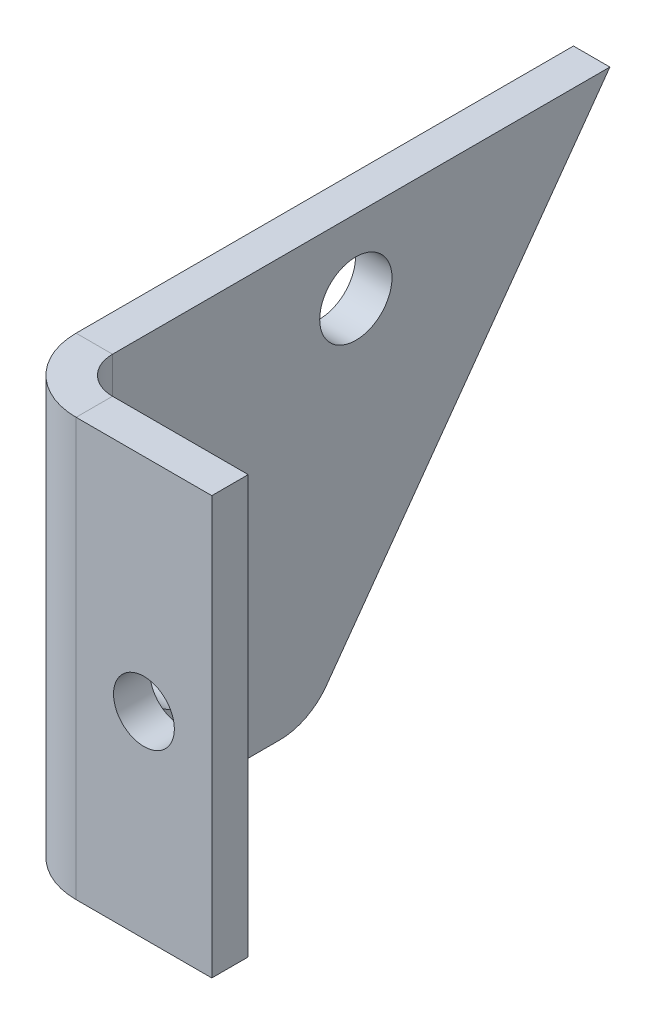
from build123d import *

# Parameters (mm, degrees)
BASE_FLANGE1_DEPTH           = 3.175
SKETCH7_R                    = 3.15
CUT_EXTRUDE3_DEPTH           = 10
EDGE_FLANGE1_STRIP_W         = 19.05
EDGE_FLANGE1_STRIP_H         = 3.175
EDGE_FLANGE1_STRIP_CUT_DEPTH = 36.40397533
EDGE_FLANGE1_DEPTH           = 36.40397533
SKETCH12_R                   = 2.65
CUT_EXTRUDE4_DEPTH           = 10


# Sheet-metal steps are written as plain solids
with BuildPart() as part:
    # Sketch2 → Base-Flange1 (new body)
    with BuildSketch(Plane(origin=(0, 0, 0), x_dir=(0, 0, -1), z_dir=(1, 0, 0))):
        with BuildLine():
            Line((0, 0), (0, 36.40397533))
            Line((0, 36.40397533), (49.693245392, 36.40397533))
            Line((49.693245392, 36.40397533), (24.989293369, 2.07924376))
            ThreePointArc((24.989293369, 2.07924376), (23.211005522, 0.550068473), (20.931069251, 0))
            Line((20.931069251, 0), (0, 0))
        make_face()
    extrude(amount=-BASE_FLANGE1_DEPTH)

    # Sketch7 → Cut-Extrude3 (cut)
    with BuildSketch(Plane.ZY.offset(3.175)):
        with Locations((-27.553898694, 30)):
            Circle(SKETCH7_R)
        with Locations((-12.587671369, 10)):
            Circle(SKETCH7_R)
    extrude(amount=-CUT_EXTRUDE3_DEPTH, mode=Mode.SUBTRACT)

    # Edge-Flange1 strip (across the edge) → Edge-Flange1 strip cut (cut)
    with BuildSketch(Plane(origin=(0, 36.40397533, 0), x_dir=(0, 0, -1), z_dir=(0, -1, 0))):
        with Locations((-3.175, -1.5875)):
            Rectangle(EDGE_FLANGE1_STRIP_W, EDGE_FLANGE1_STRIP_H)
    extrude(amount=EDGE_FLANGE1_STRIP_CUT_DEPTH, mode=Mode.SUBTRACT)

    # Edge-Flange1 section (across the edge) → Edge-Flange1 (add)
    with BuildSketch(Plane(origin=(0, 36.40397533, 0), x_dir=(0, 0, -1), z_dir=(0, -1, 0))):
        with BuildLine():
            Line((0, 3.175), (0, 15))
            Line((0, 15), (3.175, 15))
            Line((3.175, 15), (3.175, 3.175))
            ThreePointArc((3.175, 3.175), (4.10493597, 0.92993597), (6.35, 0))
            Line((6.35, 0), (6.35, -3.175))
            ThreePointArc((6.35, -3.175), (1.859871939, -1.315128061), (0, 3.175))
        make_face()
    extrude(amount=EDGE_FLANGE1_DEPTH)

    # Sketch12 → Cut-Extrude4 (cut)
    with BuildSketch(Plane(origin=(0, 0, -3.175), x_dir=(-1, 0, 0), z_dir=(0, 0, -1))):
        with Locations((-9.0875, 17.162271256)):
            Circle(SKETCH12_R)
    extrude(amount=-CUT_EXTRUDE4_DEPTH, mode=Mode.SUBTRACT)


solid = part.part
